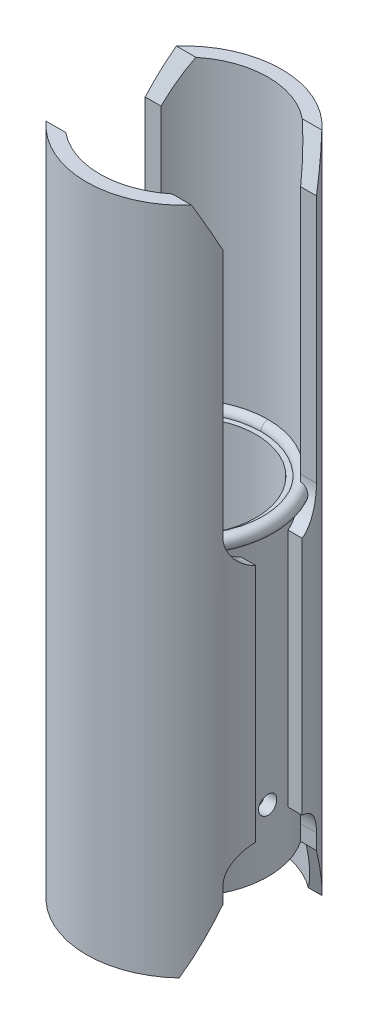
from build123d import *
from build123d.topology import SkipClean

# Parameters (mm, degrees)
ESQUISSE1_R                   = 17.963
ESQUISSE1_R_2                 = 15.4
BOSS_EXTRU_1_DEPTH            = 40.144083067
CHANFREIN1_SIZE               = 2
ESQUISSE7_R                   = 17.963
BOSS_EXTRU_4_DEPTH            = 25
ESQUISSE8_R                   = 15.4
ENL_V_MAT_EXTRU_3_DEPTH       = 48.506695773
BOSS_EXTRU_5_DEPTH            = 130
ENL_V_MAT_EXTRU_8_DEPTH       = 134.304428503
ENL_V_MAT_EXTRU_8_DEPTH_BACK  = 134.304428503
ENL_V_MAT_EXTRU_9_DEPTH       = 130
ENL_V_MAT_EXTRU_9_DEPTH_BACK  = 130
ESQUISSE21_R                  = 17.963
ESQUISSE21_R_2                = 15.25
BOSS_EXTRU_6_DEPTH            = 65.144083
ESQUISSE22_R                  = 1.95
ENL_V_MAT_EXTRU_10_DEPTH      = 64
ESQUISSE23_R                  = 1.95
ENL_V_MAT_EXTRU_11_DEPTH      = 64
R_P_TITION_LIN_AIRE2_COUNT    = 2
R_P_TITION_LIN_AIRE2_PITCH    = 16
CONG_2_R                      = 7
ESQUISSE11_R                  = 1.5
ESQUISSE24_R                  = 20.85750055
BOSS_EXTRU_10_DEPTH           = 13
ESQUISSE26_R                  = 15.25
ENL_V_MAT_EXTRU_12_DEPTH      = 134.304428631
ENL_V_MAT_EXTRU_13_DEPTH      = 134.304428631
ENL_V_MAT_EXTRU_13_DEPTH_BACK = 134.304428631
ESQUISSE29_R                  = 19
ENL_V_MAT_EXTRU_14_DEPTH      = 13
ENL_V_MAT_EXTRU_15_DEPTH      = 134.210625299
ENL_V_MAT_EXTRU_15_DEPTH_BACK = 134.210625299
ESQUISSE30_R                  = 15.4


with BuildPart() as part:
    # Esquisse1 → Boss.-Extru.1 (new body)
    with BuildSketch(Plane(origin=(0, 0, 0), x_dir=(1, 0, 0), z_dir=(0, 1, 0))):
        with Locations(Location((0, 0, 0), (0, 0, 270))):
            Circle(ESQUISSE1_R)
        with Locations(Location((0, 0, 0), (0, 0, 270))):
            Circle(ESQUISSE1_R_2, mode=Mode.SUBTRACT)
    extrude(amount=BOSS_EXTRU_1_DEPTH)

    # Chanfrein1
    chanfrein1_edges = [part.edges().sort_by_distance(p)[0] for p in [
        (0, 0, -17.963),
    ]]
    chamfer(chanfrein1_edges, length=CHANFREIN1_SIZE)

    # Esquisse7 → Boss.-Extru.4 (add)
    with BuildSketch(Plane(origin=(0, 40.144083067, 0), x_dir=(1, 0, 0), z_dir=(0, 1, 0))):
        with Locations(Location((0, 0, 0), (0, 0, 270))):
            Circle(ESQUISSE7_R)
    extrude(amount=BOSS_EXTRU_4_DEPTH)

    # Esquisse8 → Enlèv. mat.-Extru.3 (cut, through all)
    with BuildSketch(Plane.XZ.offset(-40.144083067)):
        with Locations(Location((0, 0, 0), (0, 0, 270))):
            Circle(ESQUISSE8_R)
    extrude(amount=-ENL_V_MAT_EXTRU_3_DEPTH, mode=Mode.SUBTRACT)

    # Esquisse10 → Boss.-Extru.5 (add)
    with BuildSketch(Plane(origin=(0, 0, 0), x_dir=(1, 0, 0), z_dir=(0, 1, 0))):
        with BuildLine():
            Line((20.85750055, 0), (17.963, 0))
            ThreePointArc((17.963, 0), (0, -17.963), (-17.963, 0))
            Line((-17.963, 0), (-20.85750055, 0))
            ThreePointArc((-20.85750055, 0), (0, -20.85750055), (20.85750055, 0))
        make_face()
    boss_extru_5 = extrude(amount=BOSS_EXTRU_5_DEPTH)

    # Symétrie3: Boss.-Extru.5 across plane
    with SkipClean():  # the faces are left unmerged after this step: merging them gives an invalid solid
        add(boss_extru_5.mirror(Plane.XY))

    # Esquisse18 → Enlèv. mat.-Extru.8 (cut, two sides: drawn at the far end of the back side and taken through both)
    with SkipClean():  # the faces are left unmerged after this step: merging them gives an invalid solid
        with BuildSketch(Plane(origin=(0, 0, 0), x_dir=(0, 0, -1), z_dir=(1, 0, 0)).offset(-ENL_V_MAT_EXTRU_8_DEPTH_BACK)):
            Polygon((-10, 121.154286311), (-13.911254963, 130), (13.911254963, 130), (10, 121.154286311), (10, 61.262819373), (-10, 61.262819373), align=None)
        extrude(amount=ENL_V_MAT_EXTRU_8_DEPTH + ENL_V_MAT_EXTRU_8_DEPTH_BACK, mode=Mode.SUBTRACT)

    # Esquisse20 → Enlèv. mat.-Extru.9 (cut, two sides: drawn at the far end of the back side and taken through both)
    with BuildSketch(Plane(origin=(0, 0, 0), x_dir=(0, 0, -1), z_dir=(1, 0, 0)).offset(-ENL_V_MAT_EXTRU_9_DEPTH_BACK)):
        Polygon((-5, 61.262819373), (5, 61.262819373), (5, 10.002819373), (10, 10.002819373), (10, 0), (-10, 0), (-10, 10.002819373), (-5, 10.002819373), align=None)
    extrude(amount=ENL_V_MAT_EXTRU_9_DEPTH + ENL_V_MAT_EXTRU_9_DEPTH_BACK, mode=Mode.SUBTRACT)


with BuildPart() as enl_v_mat_extru_9_piece_1:
    # of the separate pieces the step leaves, piece 1, a body of its own (enl_v_mat_extru_9_pieces)
    add(part.part.solids().sort_by_distance((-18.303970313, 0, -10))[0])



with BuildPart() as enl_v_mat_extru_9_piece_2:
    # of the separate pieces the step leaves, piece 2, a body of its own (enl_v_mat_extru_9_pieces)
    add(part.part.solids().sort_by_distance((-15.540666477, 130, 13.911254963))[0])


with BuildPart() as enl_v_mat_extru_9_piece_1_1:
    with SkipClean():  # the faces are left unmerged after this step: merging them gives an invalid solid
        add(enl_v_mat_extru_9_piece_1.part)

        add(enl_v_mat_extru_9_piece_2.part)  # Boss.-Extru.6 merges Enlèv. mat.-Extru.9 piece 2
        # Esquisse21 → Boss.-Extru.6 (add)
        with BuildSketch(Plane(origin=(0, 0, 0), x_dir=(1, 0, 0), z_dir=(0, 1, 0))):
            Circle(ESQUISSE21_R)
            with Locations(Location((0, 0, 0), (0, 0, 270))):
                Circle(ESQUISSE21_R_2, mode=Mode.SUBTRACT)
        extrude(amount=BOSS_EXTRU_6_DEPTH)

    # Esquisse22 → Enlèv. mat.-Extru.10 (cut)
    with SkipClean():  # the faces are left unmerged after this step: merging them gives an invalid solid
        with BuildSketch(Plane(origin=(0, 0, 0), x_dir=(0, 0, -1), z_dir=(1, 0, 0))):
            with Locations((0, 5)):
                Circle(ESQUISSE22_R)
        enl_v_mat_extru_10 = extrude(amount=-ENL_V_MAT_EXTRU_10_DEPTH, mode=Mode.SUBTRACT)

    # Esquisse23 → Enlèv. mat.-Extru.11 (cut)
    with SkipClean():  # the faces are left unmerged after this step: merging them gives an invalid solid
        with BuildSketch(Plane(origin=(0, 0, 0), x_dir=(0, 0, -1), z_dir=(1, 0, 0))):
            with Locations(Location((0, 13.3, 0), (0, 0, 180))):
                Circle(ESQUISSE23_R)
        extrude(amount=ENL_V_MAT_EXTRU_11_DEPTH, mode=Mode.SUBTRACT)

    # Répétition linéaire2: Enlèv. mat.-Extru.10 ×2
    with SkipClean():  # the faces are left unmerged after this step: merging them gives an invalid solid
        with Locations(*[(0, i * R_P_TITION_LIN_AIRE2_PITCH, 0) for i in range(1, R_P_TITION_LIN_AIRE2_COUNT)]):
            add(enl_v_mat_extru_10, mode=Mode.SUBTRACT)

    # Congé2
    # the kernel refuses this fillet: 7 mm, written as the material it adds along each edge
    with BuildSketch(Plane(origin=(-35.074480144, 61.262819373, 10), x_dir=(0, 1, 0), z_dir=(1, 0, 0))) as cong_2_piece_1_section:
        with BuildLine():
            CenterArc((6.708203932, -7), CONG_2_R, 90, 73.398450401)
            Line((0, -5), (-0.134164079, -4.96))
            ThreePointArc((-0.134164079, -4.96), (-0.14, -2.5), (-0.14, 0))
            Line((-0.14, 0), (0, 0.14))
            Line((0, 0.14), (6.708203932, 0.14))
            Line((6.708203932, 0.14), (6.708203932, 0))
        make_face()
    cong_2_piece_1 = extrude(amount=36.922879903, mode=Mode.PRIVATE)
    cong_2_piece_1 = cong_2_piece_1 & Plane(origin=(0, 62.883538638, 0), x_dir=(-1, 0, 0), z_dir=(0, -1, 0)) * Cylinder(20.85750055, 101, mode=Mode.PRIVATE)
    cong_2_piece_1 = cong_2_piece_1 - Plane(origin=(0, 62.883538638, 0), x_dir=(1, 0, 0), z_dir=(0, -1, 0)) * Cylinder(17.963, 101, mode=Mode.PRIVATE)
    add(cong_2_piece_1)
    with BuildSketch(Plane(origin=(-1.848399759, 61.262819373, 10), x_dir=(0, 0, -1), z_dir=(1, 0, 0))) as cong_2_piece_2_section:
        with BuildLine():
            CenterArc((7, 6.708203932), CONG_2_R, 180, 73.398450401)
            Line((0, 6.708203932), (-0.14, 6.708203932))
            Line((-0.14, 6.708203932), (-0.14, 0))
            Line((-0.14, 0), (0, -0.14))
            ThreePointArc((0, -0.14), (2.5, -0.14), (4.96, -0.134164079))
            Line((4.96, -0.134164079), (5, 0))
        make_face()
    cong_2_piece_2 = extrude(amount=36.922879903, mode=Mode.PRIVATE)
    cong_2_piece_2 = cong_2_piece_2 & Plane(origin=(0, 62.883538658, 0), x_dir=(-1, 0, 0), z_dir=(0, -1, 0)) * Cylinder(20.85750055, 101, mode=Mode.PRIVATE)
    cong_2_piece_2 = cong_2_piece_2 - Plane(origin=(0, 62.883538658, 0), x_dir=(1, 0, 0), z_dir=(0, -1, 0)) * Cylinder(17.963, 101, mode=Mode.PRIVATE)
    add(cong_2_piece_2)
    with BuildSketch(Plane(origin=(-1.848399759, 61.262819373, -10), x_dir=(0, 0, 1), z_dir=(1, 0, 0))) as cong_2_piece_3_section:
        with BuildLine():
            CenterArc((7, -6.708203932), CONG_2_R, 106.601549599, 73.398450401)
            Line((0, -6.708203932), (-0.14, -6.708203932))
            Line((-0.14, -6.708203932), (-0.14, 0))
            Line((-0.14, 0), (0, 0.14))
            ThreePointArc((0, 0.14), (2.5, 0.14), (4.96, 0.134164079))
            Line((4.96, 0.134164079), (5, 0))
        make_face()
    cong_2_piece_3 = extrude(amount=36.922879903, mode=Mode.PRIVATE)
    cong_2_piece_3 = cong_2_piece_3 & Plane(origin=(0, 62.883538748, 0), x_dir=(-1, 0, 0), z_dir=(0, -1, 0)) * Cylinder(20.85750055, 101, mode=Mode.PRIVATE)
    cong_2_piece_3 = cong_2_piece_3 - Plane(origin=(0, 62.883538748, 0), x_dir=(1, 0, 0), z_dir=(0, -1, 0)) * Cylinder(17.963, 101, mode=Mode.PRIVATE)
    add(cong_2_piece_3)
    with BuildSketch(Plane(origin=(-35.074480144, 61.262819373, -10), x_dir=(0, 0, 1), z_dir=(1, 0, 0))) as cong_2_piece_4_section:
        with BuildLine():
            CenterArc((7, -6.708203932), CONG_2_R, 106.601549599, 73.398450401)
            Line((0, -6.708203932), (-0.14, -6.708203932))
            Line((-0.14, -6.708203932), (-0.14, 0))
            Line((-0.14, 0), (0, 0.14))
            ThreePointArc((0, 0.14), (2.5, 0.14), (4.96, 0.134164079))
            Line((4.96, 0.134164079), (5, 0))
        make_face()
    cong_2_piece_4 = extrude(amount=36.922879903, mode=Mode.PRIVATE)
    cong_2_piece_4 = cong_2_piece_4 & Plane(origin=(0, 62.883538616, 0), x_dir=(-1, 0, 0), z_dir=(0, -1, 0)) * Cylinder(20.85750055, 101, mode=Mode.PRIVATE)
    cong_2_piece_4 = cong_2_piece_4 - Plane(origin=(0, 62.883538616, 0), x_dir=(1, 0, 0), z_dir=(0, -1, 0)) * Cylinder(17.963, 101, mode=Mode.PRIVATE)
    add(cong_2_piece_4)
    with BuildSketch(Plane(origin=(1.848399759, 10.002819373, -10), x_dir=(0, -1, 0), z_dir=(-1, 0, 0))) as cong_2_piece_5_section:
        with BuildLine():
            CenterArc((6.708203932, 7), CONG_2_R, 196.601549599, 73.398450401)
            Line((0, 5), (-0.134164079, 4.96))
            ThreePointArc((-0.134164079, 4.96), (-0.14, 2.5), (-0.14, 0))
            Line((-0.14, 0), (0, -0.14))
            Line((0, -0.14), (6.708203932, -0.14))
            Line((6.708203932, -0.14), (6.708203932, 0))
        make_face()
    cong_2_piece_5 = extrude(amount=36.922879903, mode=Mode.PRIVATE)
    cong_2_piece_5 = cong_2_piece_5 - Plane(origin=(0, 8.382100154, 0), x_dir=(1, 0, 0), z_dir=(0, -1, 0)) * Cylinder(17.963, 101, mode=Mode.PRIVATE)
    cong_2_piece_5 = cong_2_piece_5 & Plane(origin=(0, 8.382100154, 0), x_dir=(-1, 0, 0), z_dir=(0, -1, 0)) * Cylinder(20.85750055, 101, mode=Mode.PRIVATE)
    add(cong_2_piece_5)
    with BuildSketch(Plane(origin=(35.074480144, 10.002819373, -10), x_dir=(0, -1, 0), z_dir=(-1, 0, 0))) as cong_2_piece_6_section:
        with BuildLine():
            CenterArc((6.708203932, 7), CONG_2_R, 196.601549599, 73.398450401)
            Line((0, 5), (-0.134164079, 4.96))
            ThreePointArc((-0.134164079, 4.96), (-0.14, 2.5), (-0.14, 0))
            Line((-0.14, 0), (0, -0.14))
            Line((0, -0.14), (6.708203932, -0.14))
            Line((6.708203932, -0.14), (6.708203932, 0))
        make_face()
    cong_2_piece_6 = extrude(amount=36.922879903, mode=Mode.PRIVATE)
    cong_2_piece_6 = cong_2_piece_6 - Plane(origin=(0, 8.38209993, 0), x_dir=(1, 0, 0), z_dir=(0, -1, 0)) * Cylinder(17.963, 101, mode=Mode.PRIVATE)
    cong_2_piece_6 = cong_2_piece_6 & Plane(origin=(0, 8.38209993, 0), x_dir=(-1, 0, 0), z_dir=(0, -1, 0)) * Cylinder(20.85750055, 101, mode=Mode.PRIVATE)
    add(cong_2_piece_6)
    with BuildSketch(Plane(origin=(-1.848399759, 10.002819373, 10), x_dir=(0, -1, 0), z_dir=(1, 0, 0))) as cong_2_piece_7_section:
        with BuildLine():
            CenterArc((6.708203932, 7), CONG_2_R, 196.601549599, 73.398450401)
            Line((0, 5), (-0.134164079, 4.96))
            ThreePointArc((-0.134164079, 4.96), (-0.14, 2.5), (-0.14, 0))
            Line((-0.14, 0), (0, -0.14))
            Line((0, -0.14), (6.708203932, -0.14))
            Line((6.708203932, -0.14), (6.708203932, 0))
        make_face()
    cong_2_piece_7 = extrude(amount=36.922879903, mode=Mode.PRIVATE)
    cong_2_piece_7 = cong_2_piece_7 & Plane(origin=(0, 8.382100073, 0), x_dir=(-1, 0, 0), z_dir=(0, -1, 0)) * Cylinder(20.85750055, 101, mode=Mode.PRIVATE)
    cong_2_piece_7 = cong_2_piece_7 - Plane(origin=(0, 8.382100073, 0), x_dir=(1, 0, 0), z_dir=(0, -1, 0)) * Cylinder(17.963, 101, mode=Mode.PRIVATE)
    add(cong_2_piece_7)
    with BuildSketch(Plane(origin=(-35.074480144, 10.002819373, 10), x_dir=(0, 0, -1), z_dir=(1, 0, 0))) as cong_2_piece_8_section:
        with BuildLine():
            CenterArc((7, -6.708203932), CONG_2_R, 106.601549599, 73.398450401)
            Line((0, -6.708203932), (-0.14, -6.708203932))
            Line((-0.14, -6.708203932), (-0.14, 0))
            Line((-0.14, 0), (0, 0.14))
            ThreePointArc((0, 0.14), (2.5, 0.14), (4.96, 0.134164079))
            Line((4.96, 0.134164079), (5, 0))
        make_face()
    cong_2_piece_8 = extrude(amount=36.922879903, mode=Mode.PRIVATE)
    cong_2_piece_8 = cong_2_piece_8 & Plane(origin=(0, 8.382100055, 0), x_dir=(-1, 0, 0), z_dir=(0, -1, 0)) * Cylinder(20.85750055, 101, mode=Mode.PRIVATE)
    cong_2_piece_8 = cong_2_piece_8 - Plane(origin=(0, 8.382100055, 0), x_dir=(1, 0, 0), z_dir=(0, -1, 0)) * Cylinder(17.963, 101, mode=Mode.PRIVATE)
    add(cong_2_piece_8)

    # Balayage3: sweep along a curve in space
    with BuildLine() as balayage3_path:
        ThreePointArc((0, 65.144083067, 15.25), (10.783378413, 65.144083067, 10.783378413), (15.25, 65.144083067, 0))
        ThreePointArc((15.25, 65.144083067, 0), (10.783378413, 65.144083067, -10.783378413), (0, 65.144083067, -15.25))
        ThreePointArc((0, 65.144083067, -15.25), (-10.783378413, 65.144083067, -10.783378413), (-15.25, 65.144083067, 0))
        ThreePointArc((-15.25, 65.144083067, 0), (-10.783378413, 65.144083067, 10.783378413), (0, 65.144083067, 15.25))
    # Esquisse11 → Balayage3 (sweep)
    with BuildSketch(Plane(origin=(0, 0, 0), x_dir=(0, 0, -1), z_dir=(1, 0, 0))):
        with Locations((17.963, 65.144083067)):
            Circle(ESQUISSE11_R)
    sweep(path=balayage3_path.line)

    # Esquisse24 → Boss.-Extru.10 (add)
    with BuildSketch(Plane(origin=(0, 0, 0), x_dir=(1, 0, 0), z_dir=(0, 1, 0))):
        with Locations(Location((0, 0, 0), (0, 0, 41.83337037))):
            Circle(ESQUISSE24_R)
    extrude(amount=-BOSS_EXTRU_10_DEPTH)

    # Esquisse26 → Enlèv. mat.-Extru.12 (cut, through all)
    with BuildSketch(Plane(origin=(0, 0, 0), x_dir=(1, 0, 0), z_dir=(0, 1, 0))):
        with Locations(Location((0, 0, 0), (0, 0, 270))):
            Circle(ESQUISSE26_R)
    extrude(amount=-ENL_V_MAT_EXTRU_12_DEPTH, mode=Mode.SUBTRACT)

    # Esquisse27 → Enlèv. mat.-Extru.13 (cut, two sides: drawn at the far end of the back side and taken through both)
    with BuildSketch(Plane(origin=(0, 0, 0), x_dir=(0, 0, -1), z_dir=(1, 0, 0)).offset(-ENL_V_MAT_EXTRU_13_DEPTH_BACK)):
        Polygon((-10, 0), (-15.25, -13), (15.25, -13), (10, 0), align=None)
    extrude(amount=ENL_V_MAT_EXTRU_13_DEPTH + ENL_V_MAT_EXTRU_13_DEPTH_BACK, mode=Mode.SUBTRACT)

    # Esquisse29 → Enlèv. mat.-Extru.14 (cut)
    with BuildSketch(Plane(origin=(0, 0, 0), x_dir=(1, 0, 0), z_dir=(0, 1, 0))):
        Circle(ESQUISSE29_R)
    extrude(amount=-ENL_V_MAT_EXTRU_14_DEPTH, mode=Mode.SUBTRACT)

    # Esquisse30 → Enlèv. mat.-Extru.15 (cut, two sides: drawn at the far end of the back side and taken through both)
    with BuildSketch(Plane(origin=(0, 0, 0), x_dir=(1, 0, 0), z_dir=(0, 1, 0)).offset(-ENL_V_MAT_EXTRU_15_DEPTH_BACK)):
        with Locations(Location((0, 0, 0), (0, 0, 270))):
            Circle(ESQUISSE30_R)
    extrude(amount=ENL_V_MAT_EXTRU_15_DEPTH + ENL_V_MAT_EXTRU_15_DEPTH_BACK, mode=Mode.SUBTRACT)


solid = enl_v_mat_extru_9_piece_1_1.part
